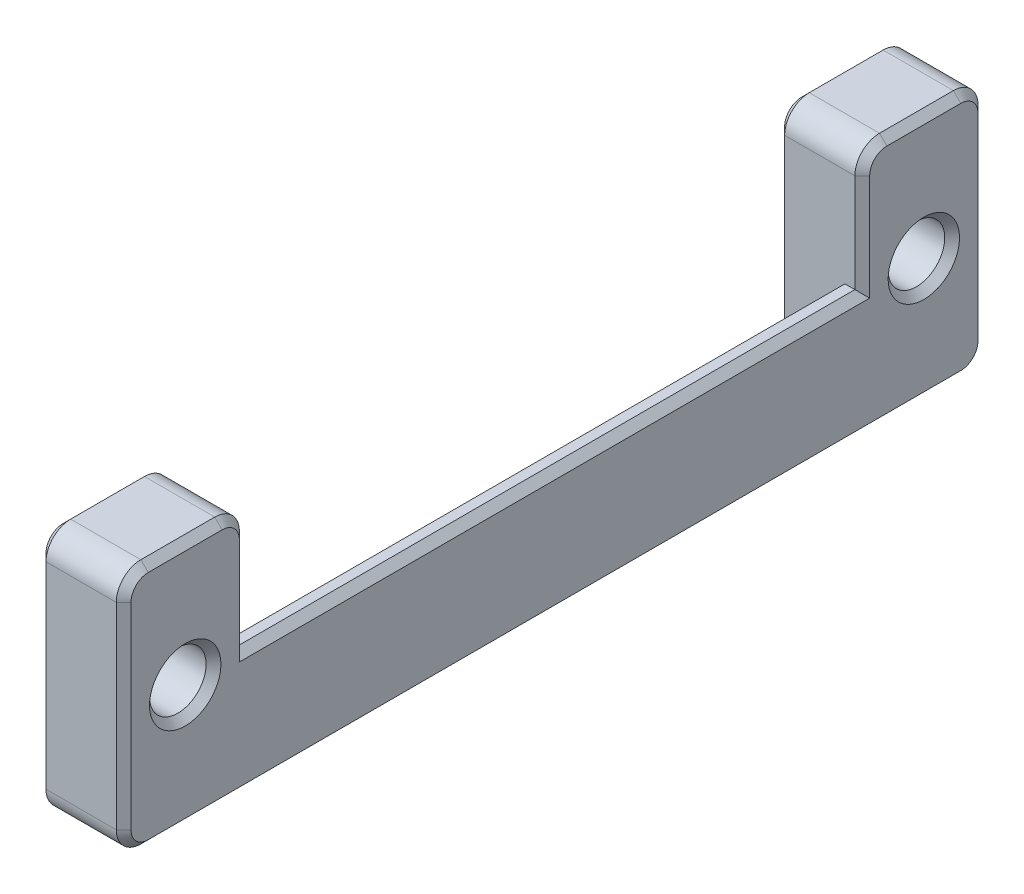
from build123d import *

# Parameters (mm, degrees)
AUFSATZ_LINEAR_AUSTRAGEN1_DEPTH = 50
SKIZZE2_W                       = 6.907618634
SKIZZE2_H                       = 20
AUFSATZ_LINEAR_AUSTRAGEN2_DEPTH = 10
AUFSATZ_LINEAR_START            = -50
SKIZZE2_2_W                     = 6.907618634
SKIZZE2_2_H                     = 20
AUFSATZ_LINEAR_AUSTRAGEN3_DEPTH = 10
FASE1_SIZE                      = 0.75
FASE1_SIZE_2                    = 0.55222801
SKIZZE3_R                       = 2.3
SCHNITT_LINEAR_AUSTRAGEN1_DEPTH = 10
VERRUNDUNG1_R                   = 2
FASE2_SIZE                      = 0.6


with BuildPart() as part:
    # Skizze1 → Aufsatz-Linear austragen1 (new body)
    with BuildSketch(Plane.XY):
        Polygon((0, 0), (0, 10), (-1.407618634, 10), (-6.907618634, 0), align=None)
    extrude(amount=AUFSATZ_LINEAR_AUSTRAGEN1_DEPTH)

    # Skizze2 → Aufsatz-Linear austragen2 (add)
    with BuildSketch(Plane.XY.offset(50)):
        with Locations((-3.453809317, 10)):
            Rectangle(SKIZZE2_W, SKIZZE2_H)
    extrude(amount=AUFSATZ_LINEAR_AUSTRAGEN2_DEPTH)

    # Skizze2<2> → Aufsatz-Linear austragen3 (add)
    with BuildSketch(Plane.XY.offset(50).offset(AUFSATZ_LINEAR_START)):
        with Locations((-3.453809317, 10)):
            Rectangle(SKIZZE2_2_W, SKIZZE2_2_H)
    extrude(amount=-AUFSATZ_LINEAR_AUSTRAGEN3_DEPTH)

    # Fase1
    # the kernel refuses this chamfer: 0.75, 0.55222801 mm, written as the material it takes off along each edge
    with BuildSketch(Plane(origin=(-6.907618634, 0, 50), x_dir=(-0.027495876610586778, 0.9996219169112968, 0), z_dir=(0, 0, 1))) as fase1_piece_1:
        Polygon((FASE1_SIZE * 0.999621916911, -FASE1_SIZE * 0.0274958766106), (-FASE1_SIZE * 0.0274958766106, -FASE1_SIZE * 0.999621916911), (0, 0), align=None)
    extrude(amount=11.928762241, mode=Mode.SUBTRACT)
    with BuildSketch(Plane(origin=(-6.907618634, 0, 0), x_dir=(-0.027495876610586778, 0.9996219169112968, 0), z_dir=(0, 0, -1))) as fase1_piece_2:
        Polygon((FASE1_SIZE * 0.999621916911, FASE1_SIZE * 0.0274958766106), (-FASE1_SIZE * 0.0274958766106, FASE1_SIZE * 0.999621916911), (0, 0), align=None)
    extrude(amount=11.928762241, mode=Mode.SUBTRACT)
    with BuildSketch(Plane(origin=(-6.907618634, 0, 0), x_dir=(0.436311778339264, 0.8997955501570503, 0), z_dir=(0, 0, 1))) as fase1_piece_3:
        Polygon((FASE1_SIZE_2 * 0.998682002669, -FASE1_SIZE_2 * 0.0513250252757), (FASE1_SIZE * 0.436311778339, -FASE1_SIZE * 0.899795550157), (0, 0), align=None)
    extrude(amount=50, mode=Mode.SUBTRACT)

    # Skizze3 → Schnitt-Linear austragen1 (cut)
    with BuildSketch(Plane.ZY.offset(6.907618634)):
        with Locations(Location((-5, 10, 0), (0, 0, 270))):
            Circle(SKIZZE3_R)
        with Locations((55, 10)):
            Circle(SKIZZE3_R)
    extrude(amount=-SCHNITT_LINEAR_AUSTRAGEN1_DEPTH, mode=Mode.SUBTRACT)

    # Verrundung1
    verrundung1_edges = [part.edges().sort_by_distance(p)[0] for p in [
        (-3.078809317, 0, -10),
        (-3.078809317, 0, 60),
        (-3.453809317, 20, 60),
        (-3.453809317, 20, 50),
        (-3.453809317, 20, 0),
        (-3.453809317, 20, -10),
    ]]
    fillet(verrundung1_edges, radius=VERRUNDUNG1_R)

    # Fase2
    fase2_edges = [part.edges().sort_by_distance(p)[0] for p in [
        (0, 0, 25),
        (0, 0.585786438, 59.414213562),
        (0, 0.585786438, -9.414213562),
        (0, 10, 60),
        (0, 10, -10),
        (0, 19.414213562, 59.414213562),
        (0, 19.414213562, -9.414213562),
        (0, 20, 55),
        (0, 20, -5),
        (0, 19.414213562, 50.585786438),
        (0, 19.414213562, -0.585786438),
        (0, 14, 50),
        (0, 14, 0),
    ]]
    chamfer(fase2_edges, length=FASE2_SIZE)
    fase2_2_edges = [part.edges().sort_by_distance(p)[0] for p in [
        (0, 10, 25),
    ]]
    chamfer(fase2_2_edges, length=FASE2_SIZE)
    fase2_3_edges = [part.edges().sort_by_distance(p)[0] for p in [
        (0, 10, 52.7),
    ]]
    chamfer(fase2_3_edges, length=FASE2_SIZE)
    fase2_4_edges = [part.edges().sort_by_distance(p)[0] for p in [
        (0, 12.3, -5),
    ]]
    chamfer(fase2_4_edges, length=FASE2_SIZE)
    fase2_5_edges = [part.edges().sort_by_distance(p)[0] for p in [
        (-6.907618634, 1.337617557, 59.887127314),
        (-6.907618634, 10, 60),
        (-6.907618634, 19.414213562, 59.414213562),
        (-6.907618634, 20, 55),
        (-6.907618634, 19.414213562, 50.585786438),
        (-6.907618634, 9.375, 50),
    ]]
    chamfer(fase2_5_edges, length=FASE2_SIZE)
    fase2_6_edges = [part.edges().sort_by_distance(p)[0] for p in [
        (-6.907618634, 1.337617557, -9.887127314),
        (-6.907618634, 10, -10),
        (-6.907618634, 19.414213562, -9.414213562),
        (-6.907618634, 20, -5),
        (-6.907618634, 19.414213562, -0.585786438),
        (-6.907618634, 9.375, 0),
    ]]
    chamfer(fase2_6_edges, length=FASE2_SIZE)
    fase2_7_edges = [part.edges().sort_by_distance(p)[0] for p in [
        (-6.907618634, 10, 52.7),
    ]]
    chamfer(fase2_7_edges, length=FASE2_SIZE)
    fase2_8_edges = [part.edges().sort_by_distance(p)[0] for p in [
        (-6.907618634, 12.3, -5),
    ]]
    chamfer(fase2_8_edges, length=FASE2_SIZE)


solid = part.part
